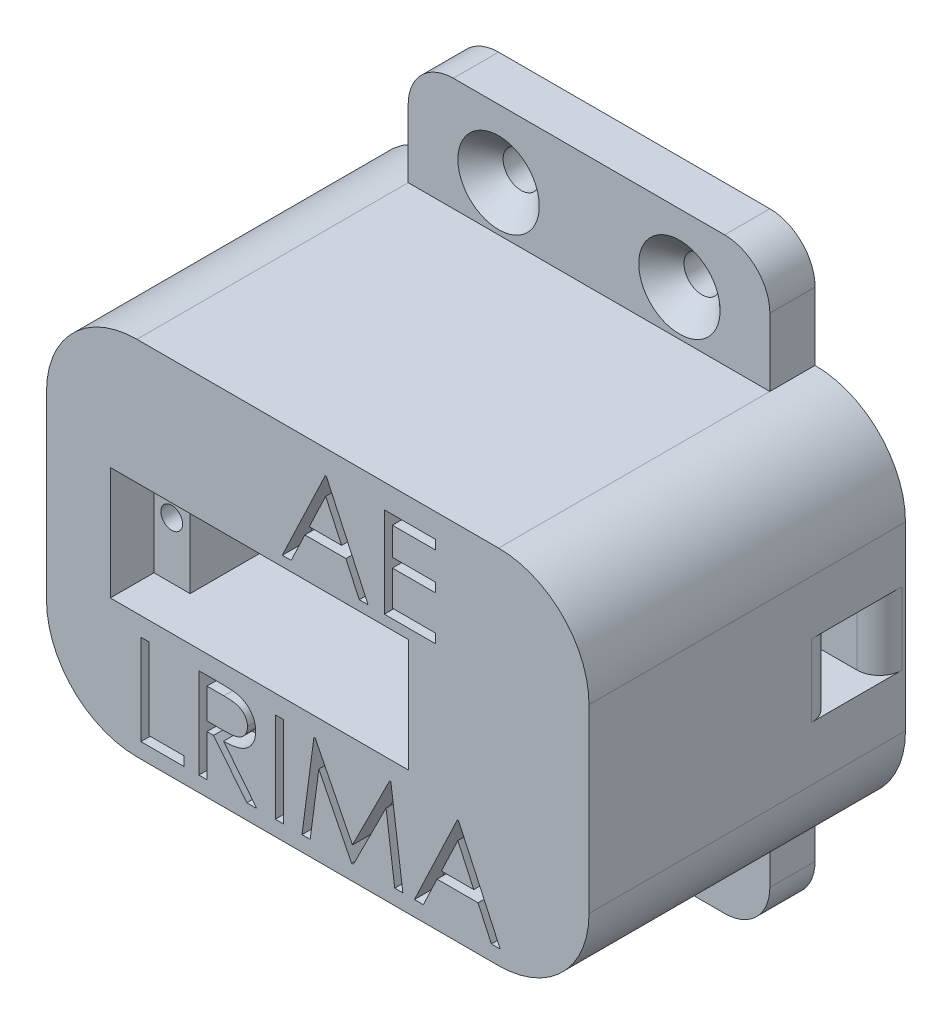
from build123d import *

# Parameters (mm, degrees)
ESQUISSE1_W             = 60
ESQUISSE1_H             = 40
BOSS_EXTRU_1_DEPTH      = 35
ENL_V_START             = -20
ESQUISSE2_W             = 23
ESQUISSE2_H             = 14.63067634
ENL_V_MAT_EXTRU_1_DEPTH = 6.25
ESQUISSE3_W             = 23
ESQUISSE3_H             = 1.61932366
ENL_V_MAT_EXTRU_2_DEPTH = 6.25
CONG_1_R                = 10
CONG_2_R                = 2.5
ESQUISSE4_W             = 40
ESQUISSE4_H             = 5
BOSS_EXTRU_2_DEPTH      = 12.5
ESQUISSE5_W             = 40
ESQUISSE5_H             = 5
BOSS_EXTRU_3_DEPTH      = 12.5
CONG_3_R                = 5
CONG_4_R                = 5
ESQUISSE6_R             = 2
ENL_V_MAT_EXTRU_3_DEPTH = 6.25
CHANFREIN1_SIZE         = 2.5
CHANFREIN2_SIZE         = 2.5
ESQUISSE7_W             = 0.897435897
ESQUISSE7_H             = 10
ENL_V_MAT_EXTRU_4_DEPTH = 2.5
ENL_V_MAT_EXTRU_5_DEPTH = 2.5
ESQUISSE9_R             = 1.2
ENL_V_MAT_EXTRU_6_DEPTH = 20
ESQUISSE11_W            = 5
ESQUISSE11_H            = 8
ENL_V_MAT_EXTRU_7_DEPTH = 40
CONG_5_R                = 2.5
CONG_6_R                = 2.5


with BuildPart() as part:
    # Esquisse1 → Boss.-Extru.1 (new body)
    with BuildSketch(Plane.XY):
        with Locations((0, 20)):
            Rectangle(ESQUISSE1_W, ESQUISSE1_H)
    extrude(amount=BOSS_EXTRU_1_DEPTH)

    # Esquisse2 → Enlèv. mat.-Extru.1 (cut, symmetric)
    with BuildSketch(Plane.XZ.offset(ENL_V_START)):
        with Locations((-6.444463633, 10.18466183)):
            Rectangle(ESQUISSE2_W, ESQUISSE2_H)
        Polygon((-18.944463633, 19.11932366), (7.055536367, 19.11932366), (7.055536367, 30.173757103), (10.055536367, 30.173757103), (10.055536367, 35), (-22.944463633, 35), (-22.944463633, 30.173757103), (-18.944463633, 30.173757103), align=None)
    extrude(amount=ENL_V_MAT_EXTRU_1_DEPTH, both=True, mode=Mode.SUBTRACT)

    # Esquisse3 → Enlèv. mat.-Extru.2 (cut, symmetric)
    with BuildSketch(Plane(origin=(0, 40, 0), x_dir=(1, 0, 0), z_dir=(0, 1, 0)).offset(ENL_V_START)):
        with Locations((-6.444463633, -18.30966183)):
            Rectangle(ESQUISSE3_W, ESQUISSE3_H)
    extrude(amount=ENL_V_MAT_EXTRU_2_DEPTH, both=True, mode=Mode.SUBTRACT)

    # Congé1
    cong_1_edges = [part.edges().sort_by_distance(p)[0] for p in [
        (30, 0, 17.5),
        (-30, 0, 17.5),
        (-30, 40, 17.5),
        (30, 40, 17.5),
    ]]
    fillet(cong_1_edges, radius=CONG_1_R)

    # Congé2
    # the kernel refuses this fillet: 2.5 mm, written as the material it takes off along each edge
    with BuildSketch(Plane(origin=(5.055536367, 13.75, 19.11932366), x_dir=(0, 0, -1), z_dir=(0, 1, 0))) as cong_2_piece_1:
        with BuildLine():
            CenterArc((2.449489743, -2.5), CONG_2_R, 90, 78.463040967)
            Line((0, -2), (-0.048989795, -1.99))
            ThreePointArc((-0.048989795, -1.99), (-0.05, -1), (-0.05, 0))
            Line((-0.05, 0), (0, 0.05))
            Line((0, 0.05), (2.449489743, 0.05))
            Line((2.449489743, 0.05), (2.449489743, 0))
        make_face()
    extrude(amount=12.5, mode=Mode.SUBTRACT)
    with BuildSketch(Plane(origin=(-17.944463633, 13.75, 19.11932366), x_dir=(-1, 0, 0), z_dir=(0, 1, 0))) as cong_2_piece_2:
        with BuildLine():
            CenterArc((2.5, -2), CONG_2_R, 126.869897646, 53.130102354)
            Line((0, -2), (-0.05, -2))
            Line((-0.05, -2), (-0.05, 0))
            Line((-0.05, 0), (0, 0.05))
            ThreePointArc((0, 0.05), (0.5, 0.05), (0.97, 0.04))
            Line((0.97, 0.04), (1, 0))
        make_face()
    extrude(amount=12.5, mode=Mode.SUBTRACT)

    # Esquisse5 → Boss.-Extru.3 (add)
    with BuildSketch(Plane(origin=(0, 40, 0), x_dir=(1, 0, 0), z_dir=(0, 1, 0))):
        with Locations((0, -2.5)):
            Rectangle(ESQUISSE5_W, ESQUISSE5_H)
    extrude(amount=BOSS_EXTRU_3_DEPTH)

    # Congé3
    cong_3_edges = [part.edges().sort_by_distance(p)[0] for p in [
        (-20, 52.5, 2.5),
        (20, 52.5, 2.5),
    ]]
    fillet(cong_3_edges, radius=CONG_3_R)


with BuildPart() as body_2:
    # Esquisse4 → Boss.-Extru.2 (new body)
    with BuildSketch(Plane.XZ):
        with Locations((0, 2.5)):
            Rectangle(ESQUISSE4_W, ESQUISSE4_H)
    extrude(amount=BOSS_EXTRU_2_DEPTH)

    # Congé4
    cong_4_edges = [body_2.edges().sort_by_distance(p)[0] for p in [
        (20, -12.5, 2.5),
        (-20, -12.5, 2.5),
    ]]
    fillet(cong_4_edges, radius=CONG_4_R)


with BuildPart() as enl_v_mat_extru_3_tool:
    # Esquisse6 → Enlèv. mat.-Extru.3 (new, symmetric)
    with BuildSketch(Plane.XY.offset(5)):
        with Locations((-10, -5)):
            Circle(ESQUISSE6_R)
        with Locations((10, -5)):
            Circle(ESQUISSE6_R)
        with Locations(Location((10, 45, 0), (0, 0, 180))):
            Circle(ESQUISSE6_R)
        with Locations(Location((-10, 45, 0), (0, 0, 180))):
            Circle(ESQUISSE6_R)
    extrude(amount=ENL_V_MAT_EXTRU_3_DEPTH, both=True)


with BuildPart() as part_1:
    add(part.part)

    # Enlèv. mat.-Extru.3: cut by enl_v_mat_extru_3_tool
    add(enl_v_mat_extru_3_tool.part, mode=Mode.SUBTRACT)

    # Chanfrein2
    chanfrein2_edges = [part_1.edges().sort_by_distance(p)[0] for p in [
        (12, 45, 5),
        (-8, 45, 5),
    ]]
    chamfer(chanfrein2_edges, length=CHANFREIN2_SIZE)

    # Esquisse7 → Enlèv. mat.-Extru.4 (cut)
    # profile 1 of 5: a face of its own
    with BuildSketch(Plane.XY.offset(35)):
        Polygon((-19.563345957, 11.682763067), (-18.665910059, 11.682763067), (-18.665910059, 2.708404093), (-14.819756213, 2.708404093), (-14.819756213, 1.682763067), (-19.563345957, 1.682763067), align=None)
    # profile 2 of 5: a face of its own
    with BuildSketch(Plane.XY.offset(35)):
        with BuildLine():
            Line((-13.153089547, 11.682763067), (-11.151887624, 11.682763067))
            add(Edge.make_bspline(
                [(-11.151887624, 11.682763067), (-11.018341542, 11.682318536), (-10.761918272, 11.681464986), (-10.394566071, 11.676705663), (-10.060774366, 11.663064647), (-9.760717682, 11.651325837), (-9.494401525, 11.629920291), (-9.261009265, 11.609461299), (-9.061615844, 11.582679411), (-8.940913412, 11.557806774), (-8.886262624, 11.546545118)],
                knots=[0, 0, 0, 0, 1.410062039, 2.707475311, 3.878576406, 4.937260626, 5.877586885, 6.699081471, 7.410979367, 8, 8, 8, 8], degree=3))
            add(Edge.make_bspline(
                [(-8.886262624, 11.546545118), (-8.81310084, 11.528468646), (-8.668338013, 11.492701321), (-8.459909253, 11.417102462), (-8.261296899, 11.32961782), (-8.073325972, 11.226864333), (-7.896937998, 11.108079248), (-7.730314252, 10.975313184), (-7.572698643, 10.829292596), (-7.430465414, 10.666335906), (-7.296353837, 10.49537445), (-7.183243476, 10.310506573), (-7.085739248, 10.117187923), (-7.0081092, 9.913452444), (-6.945600704, 9.701275953), (-6.901525734, 9.478736534), (-6.87509377, 9.246848034), (-6.872402754, 9.08868258), (-6.871038265, 9.008484221)],
                knots=[0, 0, 0, 0, 1.027469482, 2.033020251, 3.019912614, 3.986113645, 4.951240523, 5.91722682, 6.890402269, 7.87763091, 8.8651537, 9.85103654, 10.82876324, 11.815024772, 12.821070561, 13.842952187, 14.906261191, 16, 16, 16, 16], degree=3))
            add(Edge.make_bspline(
                [(-6.871038265, 9.008484221), (-6.875235402, 8.875241065), (-6.883425104, 8.615249156), (-6.959782543, 8.237932352), (-7.084858314, 7.885962882), (-7.257210568, 7.559783917), (-7.476694785, 7.265753501), (-7.740479902, 7.007495058), (-8.048713078, 6.791381022), (-8.33565398, 6.641515865), (-8.589123122, 6.545536126), (-8.79778973, 6.478003672), (-9.025409666, 6.425826629), (-9.269802051, 6.379083395), (-9.531983924, 6.34379284), (-9.811326893, 6.317945427), (-10.108030184, 6.301791002), (-10.311856096, 6.299385274), (-10.416711342, 6.298147682)],
                knots=[0, 0, 0, 0, 1.260483769, 2.459530307, 3.627416485, 4.787058657, 5.939039949, 7.08810263, 8.267026773, 9.491475466, 10.141966685, 10.831826277, 11.566392101, 12.351337768, 13.187381173, 14.07005841, 15.007169909, 16, 16, 16, 16], degree=3))
            Line((-10.416711342, 6.298147682), (-6.742833136, 1.682763067))
            Line((-6.742833136, 1.682763067), (-7.852608777, 1.682763067))
            Line((-7.852608777, 1.682763067), (-11.526486983, 6.298147682))
            Line((-11.526486983, 6.298147682), (-12.255653649, 6.298147682))
            Line((-12.255653649, 6.298147682), (-12.255653649, 1.682763067))
            Line((-12.255653649, 1.682763067), (-13.153089547, 1.682763067))
            Line((-13.153089547, 1.682763067), (-13.153089547, 11.682763067))
        make_face()
        with BuildLine():
            Line((-12.255653649, 10.657122041), (-12.255653649, 7.323788708))
            Line((-12.255653649, 7.323788708), (-10.424724162, 7.309766272))
            add(Edge.make_bspline(
                [(-10.424724162, 7.309766272), (-10.339238337, 7.309728453), (-10.173542459, 7.309655149), (-9.933826274, 7.321065938), (-9.710625955, 7.334046848), (-9.504795234, 7.353902121), (-9.316242162, 7.379490897), (-9.145060981, 7.411499423), (-8.990972262, 7.448791031), (-8.811262152, 7.506509962), (-8.610586348, 7.597955728), (-8.392496463, 7.73100001), (-8.206775498, 7.898340351), (-8.04986732, 8.089693082), (-7.92378323, 8.300082365), (-7.834891646, 8.526986277), (-7.778484668, 8.764676557), (-7.771831681, 8.928042579), (-7.768474162, 9.010487426)],
                knots=[0, 0, 0, 0, 1.146690395, 2.22261258, 3.21895312, 4.145990853, 4.996080663, 5.770904154, 6.481378293, 7.121626537, 8.300444488, 9.431385265, 10.535395872, 11.636531494, 12.74115979, 13.810798291, 14.895190096, 16, 16, 16, 16], degree=3))
            add(Edge.make_bspline(
                [(-7.768474162, 9.010487426), (-7.771908794, 9.090906208), (-7.77871498, 9.25026689), (-7.83428289, 9.483569491), (-7.928252552, 9.703760777), (-8.054887517, 9.90994502), (-8.209170817, 10.097104265), (-8.390078853, 10.257238988), (-8.592665125, 10.389380316), (-8.782011406, 10.473821403), (-8.951252013, 10.525592412), (-9.098193899, 10.562024309), (-9.264226692, 10.59129422), (-9.450156574, 10.614745822), (-9.655189805, 10.634902806), (-9.880363094, 10.648479316), (-10.124182466, 10.656518928), (-10.293173698, 10.656916325), (-10.380653649, 10.657122041)],
                knots=[0, 0, 0, 0, 1.101028733, 2.181837193, 3.264309656, 4.369019818, 5.486613113, 6.575447106, 7.666700264, 8.788928104, 9.402425223, 10.0903467, 10.862060571, 11.710948788, 12.657782767, 13.684531032, 14.801375019, 16, 16, 16, 16], degree=3))
            Line((-10.380653649, 10.657122041), (-12.255653649, 10.657122041))
        make_face(mode=Mode.SUBTRACT)
    # profile 3 of 5: a face of its own
    with BuildSketch(Plane.XY.offset(35)):
        with Locations((-4.242833136, 6.682763067)):
            Rectangle(ESQUISSE7_W, ESQUISSE7_H)
    # profile 4 of 5: a face of its own
    with BuildSketch(Plane.XY.offset(35)):
        Polygon((-1.742833136, 1.682763067), (-0.422720957, 11.682763067), (-0.294515829, 11.682763067), (3.834089941, 3.477634862), (7.952679684, 11.682763067), (8.082888017, 11.682763067), (9.411013017, 1.682763067), (8.50957071, 1.682763067), (7.552038658, 8.878275887), (3.942263017, 1.682763067), (3.7399393, 1.682763067), (0.116141223, 8.894301528), (-0.839387624, 1.682763067), align=None)
    # profile 5 of 5: a face of its own
    with BuildSketch(Plane.XY.offset(35)):
        Polygon((15.564859171, 11.682763067), (20.180243787, 1.682763067), (19.204682889, 1.682763067), (17.726317505, 4.887891272), (13.1930643, 4.887891272), (11.672631607, 1.682763067), (10.6930643, 1.682763067), (15.436654043, 11.682763067), align=None)
        Polygon((15.490740582, 9.733644477), (13.679843146, 5.913532298), (17.253561094, 5.913532298), align=None, mode=Mode.SUBTRACT)
    extrude(amount=-ENL_V_MAT_EXTRU_4_DEPTH, mode=Mode.SUBTRACT)

    # Esquisse8 → Enlèv. mat.-Extru.5 (cut)
    # profile 1 of 2: a face of its own
    with BuildSketch(Plane.XY.offset(35)):
        Polygon((0.948409565, 37.345975228), (5.56379418, 27.345975228), (4.588233283, 27.345975228), (3.109867898, 30.551103433), (-1.423385307, 30.551103433), (-2.943817999, 27.345975228), (-3.923385307, 27.345975228), (0.820204437, 37.345975228), align=None)
        Polygon((0.874290975, 35.396856639), (-0.936606461, 31.576744459), (2.637111488, 31.576744459), align=None, mode=Mode.SUBTRACT)
    # profile 2 of 2: a face of its own
    with BuildSketch(Plane.XY.offset(35)):
        Polygon((7.358665975, 37.345975228), (12.999691616, 37.345975228), (12.999691616, 36.320334203), (8.256101873, 36.320334203), (8.256101873, 33.243411126), (12.999691616, 33.243411126), (12.999691616, 32.2177701), (8.256101873, 32.2177701), (8.256101873, 28.371616254), (12.999691616, 28.371616254), (12.999691616, 27.345975228), (7.358665975, 27.345975228), align=None)
    extrude(amount=-ENL_V_MAT_EXTRU_5_DEPTH, mode=Mode.SUBTRACT)

    # Esquisse9 → Enlèv. mat.-Extru.6 (cut)
    with BuildSketch(Plane.XY.offset(19.11932366)):
        with Locations(Location((-20.977931179, 20, 0), (0, 0, 180))):
            Circle(ESQUISSE9_R)
        with Locations((8.089003913, 20)):
            Circle(ESQUISSE9_R)
    extrude(amount=ENL_V_MAT_EXTRU_6_DEPTH, mode=Mode.SUBTRACT)

    # Esquisse11 → Enlèv. mat.-Extru.7 (cut)
    with BuildSketch(Plane.ZY.offset(-5.055536367)):
        with Locations((5.36932366, 20)):
            Rectangle(ESQUISSE11_W, ESQUISSE11_H)
    extrude(amount=-ENL_V_MAT_EXTRU_7_DEPTH, mode=Mode.SUBTRACT)

    # Congé5
    cong_5_edges = [part_1.edges().sort_by_distance(p)[0] for p in [
        (30, 20, 2.86932366),
        (30, 20, 7.86932366),
    ]]
    fillet(cong_5_edges, radius=CONG_5_R)

    # Congé6
    # the kernel refuses this fillet: 2.5 mm, written as the material it takes off along each edge
    with BuildSketch(Plane(origin=(5.055536367, 16, 2.86932366), x_dir=(0, -1, 0), z_dir=(0, 0, 1)), Plane(origin=(5.055536367, 24, 7.86932366), x_dir=(0, 1, 0), z_dir=(0, 0, -1))) as cong_6_piece_1:
        with BuildLine():
            CenterArc((2.5, 2.487468593), CONG_6_R, 180, 84.260829523)
            Line((0, 2.487468593), (-0.05, 2.487468593))
            Line((-0.05, 2.487468593), (-0.05, 0))
            Line((-0.05, 0), (0, -0.05))
            ThreePointArc((0, -0.05), (1.125, -0.05), (2.245, -0.049749372))
            Line((2.245, -0.049749372), (2.25, 0))
        make_face()
    extrude(amount=5, mode=Mode.SUBTRACT)


with BuildPart() as body_2_1:
    add(body_2.part)

    # Enlèv. mat.-Extru.3: cut by enl_v_mat_extru_3_tool
    add(enl_v_mat_extru_3_tool.part, mode=Mode.SUBTRACT)

    # Chanfrein1
    chanfrein1_edges = [body_2_1.edges().sort_by_distance(p)[0] for p in [
        (8, -5, 5),
        (-12, -5, 5),
    ]]
    chamfer(chanfrein1_edges, length=CHANFREIN1_SIZE)


solid = Compound([part_1.part, body_2_1.part])
